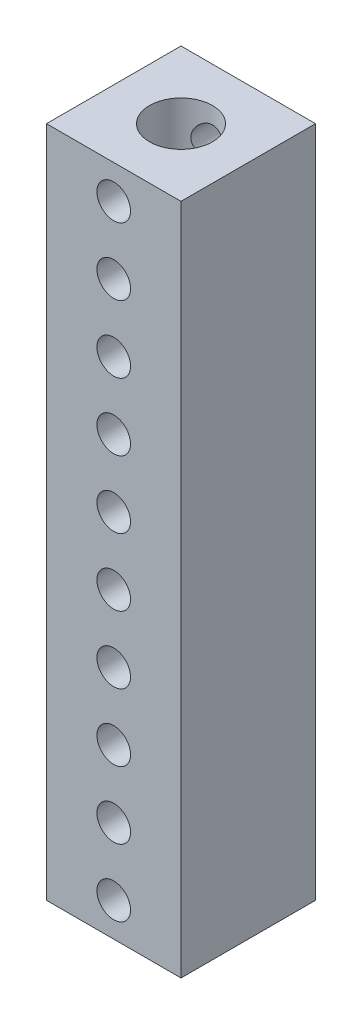
from build123d import *

# Parameters (mm, degrees)
SKETCH1_W           = 20
SKETCH1_H           = 20
SKETCH1_R           = 4.683092763
BOSS_EXTRUDE1_DEPTH = 100
SKETCH2_R           = 2.5
CUT_EXTRUDE1_DEPTH  = 100
LPATTERN1_COUNT     = 8
LPATTERN1_PITCH     = 10
SKETCH3_R           = 2.5
CUT_EXTRUDE4_DEPTH  = 103.469507777


with BuildPart() as part:
    # Sketch1 → Boss-Extrude1 (new body)
    with BuildSketch(Plane(origin=(0, 0, 0), x_dir=(1, 0, 0), z_dir=(0, 1, 0))):
        Rectangle(SKETCH1_W, SKETCH1_H)
        Circle(SKETCH1_R, mode=Mode.SUBTRACT)
    extrude(amount=BOSS_EXTRUDE1_DEPTH)

    # Sketch2 → Cut-Extrude1 (cut)
    with BuildSketch(Plane.XY.offset(10)):
        with Locations((0, 5)):
            Circle(SKETCH2_R)
    cut_extrude1 = extrude(amount=-CUT_EXTRUDE1_DEPTH, mode=Mode.SUBTRACT)

    # LPattern1: Cut-Extrude1 ×8
    with Locations(*[(0, i * LPATTERN1_PITCH, 0) for i in range(1, LPATTERN1_COUNT)]):
        add(cut_extrude1, mode=Mode.SUBTRACT)

    # Sketch3 → Cut-Extrude4 (cut, through all)
    with BuildSketch(Plane.XY.offset(10)):
        with Locations((0, 95)):
            Circle(SKETCH3_R)
        with Locations((0, 85)):
            Circle(SKETCH3_R)
    extrude(amount=-CUT_EXTRUDE4_DEPTH, mode=Mode.SUBTRACT)


solid = part.part
